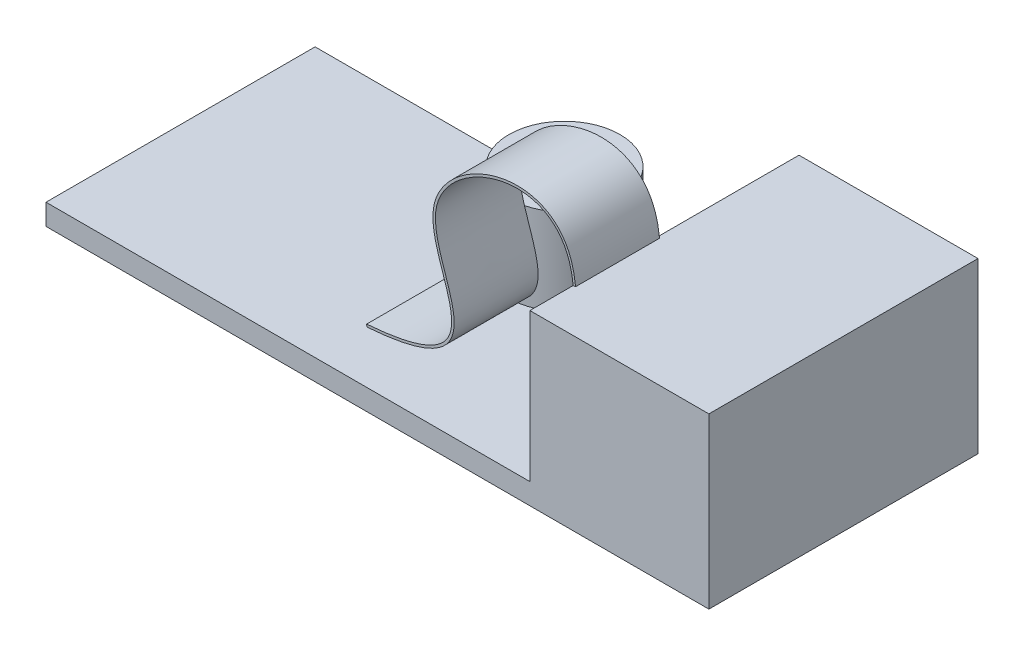
from build123d import *

# Parameters (mm, degrees)
SKETCH1_W           = 53.7
SKETCH1_H           = 21.8
BOSS_EXTRUDE1_DEPTH = 1.7
SKETCH2_W           = 14.5
SKETCH2_H           = 21.8
BOSS_EXTRUDE2_DEPTH = 12
BOSS_EXTRUDE3_DEPTH = 6.8
SKETCH4_R           = 4.5
BOSS_EXTRUDE4_DEPTH = 7


with BuildPart() as part:
    # Sketch1 → Boss-Extrude1 (new body)
    with BuildSketch(Plane(origin=(0, 0, 0), x_dir=(1, 0, 0), z_dir=(0, 1, 0))):
        with Locations((26.85, 10.9)):
            Rectangle(SKETCH1_W, SKETCH1_H)
    extrude(amount=BOSS_EXTRUDE1_DEPTH)

    # Sketch2 → Boss-Extrude2 (add)
    with BuildSketch(Plane(origin=(0, 1.7, 0), x_dir=(1, 0, 0), z_dir=(0, 1, 0))):
        with Locations((46.45, 10.9)):
            Rectangle(SKETCH2_W, SKETCH2_H)
    extrude(amount=BOSS_EXTRUDE2_DEPTH)

    # Sketch4 → Boss-Extrude4 (add)
    with BuildSketch(Plane(origin=(0, 1.7, 0), x_dir=(1, 0, 0), z_dir=(0, 1, 0))):
        with Locations((25.5, 16.5)):
            Circle(SKETCH4_R)
    extrude(amount=BOSS_EXTRUDE4_DEPTH)


with BuildPart() as body_2:
    # Sketch3 → Boss-Extrude3 (new body)
    with BuildSketch(Plane.XY.offset(-3.5)):
        with BuildLine():
            Line((39.2, 13.7), (39.399104786, 13.718901958))
            add(Edge.make_bspline(
                [(39.399104786, 13.718901958), (39.37716637, 13.949991445), (39.312900137, 14.422722145), (39.121163674, 15.257604809), (38.762934197, 16.168832029), (38.168169426, 17.036855896), (37.189876498, 17.910500102), (35.699484662, 18.487221271), (33.719854527, 18.478167154), (31.745006015, 17.894754952), (29.377277148, 16.502877604), (27.780674525, 14.364129981), (27.842717967, 11.932579741), (28.357836119, 10.111287242), (28.994339416, 8.332214987), (29.422219371, 6.674833479), (29.330934537, 5.254184283), (28.614392477, 4.277524246), (27.439642851, 3.606350644), (26.21323705, 3.181637282), (24.860216287, 2.90360878), (23.583056392, 2.734797552), (22.83643137, 2.666133946), (22.475855855, 2.639010515)],
                knots=[0, 0, 0, 0, 0.015625, 0.03125, 0.0625, 0.09375, 0.125, 0.1875, 0.25, 0.3125, 0.375, 0.5, 0.5625, 0.625, 0.6875, 0.75, 0.8125, 0.875, 0.90625, 0.9375, 0.96875, 0.984375, 1, 1, 1, 1], degree=3))
            Line((22.475855855, 2.639010515), (22.490857993, 2.439573969))
            add(Edge.make_bspline(
                [(39.2, 13.7), (38.487619517, 21.203898001), (19.665936796, 15.106413478), (34.703585042, 3.358247179), (22.490857993, 2.439573969)],
                knots=[0, 0, 0, 0, 0.499649345, 1, 1, 1, 1], degree=3))
        make_face()
    extrude(amount=-BOSS_EXTRUDE3_DEPTH)


solid = Compound([part.part, body_2.part])
